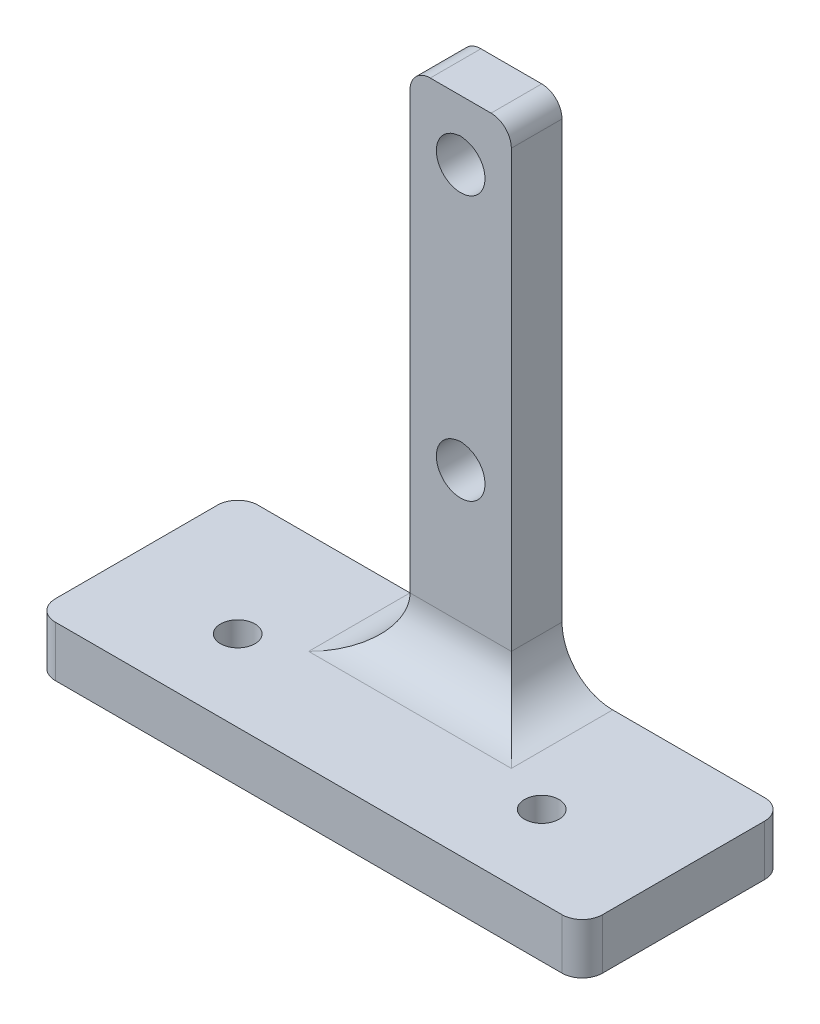
from build123d import *

# Parameters (mm, degrees)
SKETCH1_W               = 54
SKETCH1_H               = 20
BOSS_EXTRUDE1_DEPTH     = 5
BOSS_EXTRUDE2_OUTLINE_W = 10
BOSS_EXTRUDE2_OUTLINE_H = 5
BOSS_EXTRUDE2_DEPTH     = 50
M3_CLEARANCE_HOLE2_D    = 3.4
FILLET1_R               = 2
CUT_EXTRUDE6_DEPTH      = 13
CUT_EXTRUDE8_DEPTH      = 13
FILLET3_R               = 5


# Read off the part's stored shape, not the designer's step: Boss-Extrude2
with BuildPart() as part:
    # Sketch1 → Boss-Extrude1 (new body)
    with BuildSketch(Plane(origin=(0, 0, 0), x_dir=(1, 0, 0), z_dir=(0, 1, 0))):
        Rectangle(SKETCH1_W, SKETCH1_H)
    extrude(amount=BOSS_EXTRUDE1_DEPTH)

    # Boss-Extrude2 outline → Boss-Extrude2 (add)
    with BuildSketch(Plane(origin=(0, 5, 0), x_dir=(1, 0, 0), z_dir=(0, 1, 0))):
        with Locations((0, 7.5)):
            Rectangle(BOSS_EXTRUDE2_OUTLINE_W, BOSS_EXTRUDE2_OUTLINE_H)
    extrude(amount=BOSS_EXTRUDE2_DEPTH)

    # M3 Clearance Hole2 (through all)
    with Locations(Plane(origin=(0, 5, 0), x_dir=(1, 0, 0), z_dir=(0, 1, 0))):
        with Locations((15, -2), (-15, -2)):
            Hole(M3_CLEARANCE_HOLE2_D / 2)

    # Fillet1
    fillet1_edges = [part.edges().sort_by_distance(p)[0] for p in [
        (27, 2.5, 10),
        (-27, 2.5, 10),
        (5, 55, -7.5),
        (-5, 55, -7.5),
        (-27, 2.5, -10),
        (27, 2.5, -10),
    ]]
    fillet(fillet1_edges, radius=FILLET1_R)

    # Sketch16 → Cut-Extrude6 (cut)
    with BuildSketch(Plane.XY.offset(-5)):
        with BuildLine():
            Line((0, 51.537856262), (-0.416755626, 51.464371001))
            ThreePointArc((-0.416755626, 51.464371001), (0, 46.700832394), (0.416755626, 51.464371001))
            Line((0.416755626, 51.464371001), (0, 51.537856262))
        make_face()
    extrude(amount=-CUT_EXTRUDE6_DEPTH, mode=Mode.SUBTRACT)

    # Sketch17 → Cut-Extrude8 (cut)
    with BuildSketch(Plane.XY.offset(-5)):
        with BuildLine():
            Line((0, 25.437023869), (-0.416755626, 25.363538607))
            ThreePointArc((-0.416755626, 25.363538607), (0, 20.6), (0.416755626, 25.363538607))
            Line((0.416755626, 25.363538607), (0, 25.437023869))
        make_face()
    extrude(amount=-CUT_EXTRUDE8_DEPTH, mode=Mode.SUBTRACT)

    # Fillet3
    fillet3_edges = [part.edges().sort_by_distance(p)[0] for p in [
        (-5, 5, -7.5),
        (0, 5, -5),
        (5, 5, -7.5),
    ]]
    fillet(fillet3_edges, radius=FILLET3_R)


solid = part.part
